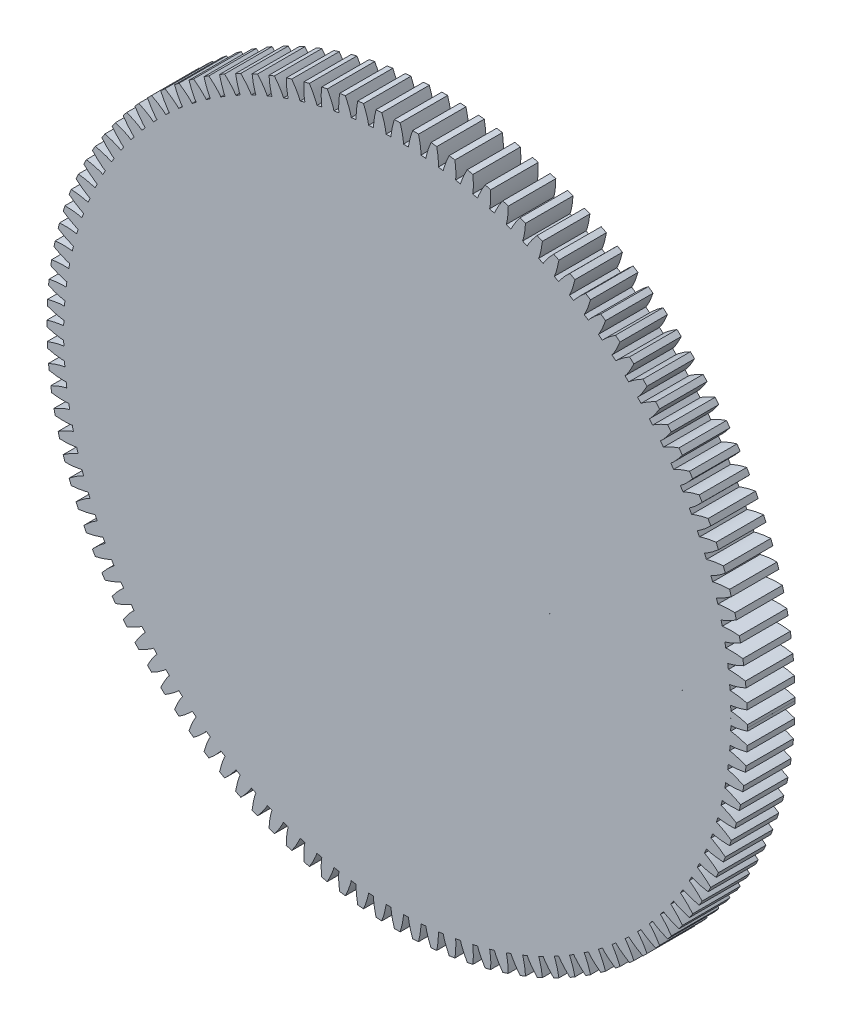
from build123d import *

# Parameters (mm, degrees)
SKETCH1_W          = 51.646666667
SKETCH1_H          = 7
REVOLVE1_ANGLE     = 359.999695921
CUT_EXTRUDE2_DEPTH = 8
CIRPATTERN2_COUNT  = 120


with BuildPart() as part:
    # Sketch1 → Revolve1 (revolve)
    with BuildSketch(Plane(origin=(0, 0, 0), x_dir=(1, 0, 0), z_dir=(0, 1, 0))):
        with Locations((25.823333334, -3.5)):
            Rectangle(SKETCH1_W, SKETCH1_H)
    revolve(axis=Axis((0, 0, 1), (0, 0, 1)), revolution_arc=REVOLVE1_ANGLE)

    # Sketch2 → Cut-Extrude2 (cut, symmetric)
    with BuildSketch(Plane.XY):
        with BuildLine():
            add(Edge.make_bspline(
                [(49.173360836, 0.916442482), (49.18384042, 0.916566717), (49.203665183, 0.916389865), (49.236041745, 0.915655843), (49.281069512, 0.913831713), (49.334507278, 0.910924832), (49.397549658, 0.906541371), (49.466941868, 0.900717551), (49.542570383, 0.893292773), (49.61814797, 0.884920963), (49.693667957, 0.875669666), (49.769018057, 0.865640989), (49.860443016, 0.85252946), (49.97028668, 0.83546689), (50.099019249, 0.813561678), (50.245444605, 0.786397355), (50.395173351, 0.756216682), (50.542926147, 0.724464621), (50.692735499, 0.690005779), (50.838058678, 0.654980248), (50.989598286, 0.61614374), (51.129772372, 0.579049403), (51.287526258, 0.53475208), (51.415036017, 0.498206745), (51.54737887, 0.458157207), (51.611885358, 0.438324893), (51.64489264, 0.428045811)],
                knots=[1.3e-07, 1.3e-07, 1.3e-07, 1.3e-07, 1.3e-07, 0.015083688, 0.02853182, 0.04661014, 0.06485485, 0.092110526, 0.119476176, 0.146842496, 0.174208854, 0.201574956, 0.228941013, 0.256307345, 0.307035032, 0.361767352, 0.416499661, 0.471231937, 0.525964282, 0.580696616, 0.635428982, 0.690161387, 0.744893688, 0.799626082, 0.854358407, 0.909090989, 0.909090989, 0.909090989, 0.909090989, 0.909090989], degree=4))
            add(Edge.make_bspline(
                [(51.64489264, 0.428045811), (51.729651536, 0.428748255), (51.893906687, 0.430109643), (52.306530901, 0.433529575), (52.626157698, 0.436178722), (53.078541106, 0.439928189), (53.448425948, 0.442993886), (53.867627873, 0.446468337), (54.246446373, 0.449608079), (54.654621988, 0.45299114), (55.038305363, 0.456171204), (55.432204014, 0.459435934), (55.822263272, 0.462668842), (56.205473452, 0.465844984), (56.602827488, 0.469138353), (56.995750762, 0.472394999), (57.400093172, 0.47574629), (57.791188074, 0.478987782), (58.210246004, 0.482461039), (58.578360763, 0.485512066), (59.036526598, 0.489309459), (59.34843758, 0.491894655), (59.757270843, 0.495283167), (59.9172769, 0.496609337), (59.997819258, 0.497276892)],
                knots=[0.083333333, 0.083333333, 0.083333333, 0.083333333, 0.083333333, 0.123922085, 0.164486989, 0.203919128, 0.245640644, 0.283463065, 0.324862637, 0.363448184, 0.401437538, 0.443624084, 0.479586386, 0.519793574, 0.557377518, 0.596757987, 0.637386485, 0.67814217, 0.716036134, 0.757316468, 0.797189789, 0.837516216, 0.878097019, 0.916666667, 0.916666667, 0.916666667, 0.916666667, 0.916666667], degree=4))
            add(Edge.make_bspline(
                [(59.997819258, 0.497276892), (59.997642726, 0.518575974), (59.997269865, 0.560059567), (59.996273068, 0.664565782), (59.995261818, 0.744519575), (59.993781282, 0.86011974), (59.992303561, 0.954280053), (59.990545534, 1.061376264), (59.988676117, 1.160666778), (59.986596883, 1.264627477), (59.984361083, 1.365842191), (59.981947021, 1.468566009), (59.97935042, 1.570614564), (59.976602654, 1.672659161), (59.973637258, 1.775368542), (59.970572825, 1.876561557), (59.967208328, 1.9804886), (59.963878718, 2.079740878), (59.960029353, 2.186782325), (59.956577079, 2.280890933), (59.952005541, 2.396410157), (59.948830947, 2.476307301), (59.944356945, 2.580722462), (59.942558211, 2.622168717), (59.941619794, 2.643447849)],
                knots=[0.083333333, 0.083333333, 0.083333333, 0.083333333, 0.083333333, 0.123015873, 0.162698413, 0.202380952, 0.242063492, 0.281746032, 0.321428571, 0.361111111, 0.400793651, 0.44047619, 0.48015873, 0.51984127, 0.55952381, 0.599206349, 0.638888889, 0.678571429, 0.718253968, 0.757936508, 0.797619048, 0.837301587, 0.876984127, 0.916666667, 0.916666667, 0.916666667, 0.916666667, 0.916666667], degree=4))
            add(Edge.make_bspline(
                [(59.941619794, 2.643447849), (59.858319983, 2.639774296), (59.703135353, 2.632930595), (59.312499408, 2.615703403), (59.020783244, 2.60283861), (58.606088921, 2.584550435), (58.260277324, 2.569300013), (57.859465495, 2.551624061), (57.496042248, 2.535596959), (57.099188575, 2.518095563), (56.729728777, 2.501802247), (56.36779352, 2.485840766), (56.0012911, 2.469677871), (55.634949418, 2.453522065), (55.258889689, 2.43693769), (54.870819425, 2.419823645), (54.487394379, 2.402914456), (54.08400337, 2.385124761), (53.704331692, 2.368381097), (53.295388965, 2.350346569), (52.936963291, 2.334539862), (52.521463085, 2.316216147), (52.219639536, 2.302905615), (51.83711307, 2.286036054), (51.677727668, 2.279007097), (51.596517476, 2.275425697)],
                knots=[0.083333333, 0.083333333, 0.083333333, 0.083333333, 0.083333333, 0.123260854, 0.159318546, 0.197811954, 0.233027389, 0.269069906, 0.309877622, 0.349805143, 0.383267774, 0.424652171, 0.459252987, 0.493239183, 0.530412296, 0.570339816, 0.610221809, 0.64719005, 0.685114365, 0.729048295, 0.765971008, 0.80369045, 0.838966589, 0.877740749, 0.916666667, 0.916666667, 0.916666667, 0.916666667, 0.916666667], degree=4))
            add(Edge.make_bspline(
                [(49.153933527, 1.658348376), (49.164405251, 1.658772771), (49.18419359, 1.659986928), (49.216487364, 1.662414403), (49.261357955, 1.666592604), (49.314570352, 1.672292218), (49.377296922, 1.679969055), (49.446289237, 1.689416601), (49.521425523, 1.700789294), (49.596461387, 1.713105056), (49.671393701, 1.726296086), (49.746115676, 1.740254538), (49.836729136, 1.75813291), (49.945529277, 1.78092087), (50.072938992, 1.809533404), (50.217742007, 1.844323811), (50.36568602, 1.882299318), (50.511574552, 1.921740649), (50.659375159, 1.963992682), (50.802666082, 2.006575839), (50.951965465, 2.053290093), (51.09000608, 2.097669738), (51.245225426, 2.150162554), (51.370647803, 2.19333115), (51.500713254, 2.240252091), (51.564093395, 2.263433234), (51.596517476, 2.275425697)],
                knots=[0, 0, 0, 0, 0, 0.015083688, 0.02853182, 0.04661014, 0.06485485, 0.092110526, 0.119476176, 0.146842496, 0.174208854, 0.201574956, 0.228941013, 0.256307345, 0.307035032, 0.361767352, 0.416499661, 0.471231937, 0.525964282, 0.580696616, 0.635428982, 0.690161387, 0.744893688, 0.799626082, 0.854358407, 0.909090914, 0.909090914, 0.909090914, 0.909090914, 0.909090914], degree=4))
            add(Edge.make_bspline(
                [(49.153933527, 1.658348376), (49.154108307, 1.651673792), (49.154470369, 1.637847201), (49.155394419, 1.602559154), (49.156132466, 1.574374293), (49.157191942, 1.53391451), (49.158022611, 1.502192549), (49.158936078, 1.467308675), (49.159760078, 1.435841366), (49.160615387, 1.403178438), (49.161472634, 1.370441506), (49.162329541, 1.337717544), (49.16321808, 1.303785607), (49.164140847, 1.268546544), (49.165096303, 1.232059161), (49.166073376, 1.194746248), (49.167055942, 1.157223577), (49.167961336, 1.122647945), (49.168938851, 1.085318177), (49.169802717, 1.052328445), (49.170922006, 1.009584531), (49.171686192, 0.980401459), (49.172743501, 0.940024439), (49.173154617, 0.924324558), (49.173360836, 0.916442482)],
                knots=[0.083333333, 0.083333333, 0.083333333, 0.083333333, 0.083333333, 0.119319483, 0.159812843, 0.201093178, 0.243303571, 0.280291323, 0.314751221, 0.350761218, 0.38877442, 0.424593636, 0.463226877, 0.497138278, 0.541351877, 0.583276099, 0.626201923, 0.666552198, 0.706902473, 0.743675595, 0.785599817, 0.828954899, 0.874170101, 0.916666667, 0.916666667, 0.916666667, 0.916666667, 0.916666667], degree=4))
        make_face()
    cut_extrude2 = extrude(amount=CUT_EXTRUDE2_DEPTH, both=True, mode=Mode.SUBTRACT)

    # CirPattern2: Cut-Extrude2 ×120 about axis
    cirpattern2_axis = Axis((0, 0, 7), (0, 0, -1))
    for i in range(1, CIRPATTERN2_COUNT):
        add(cut_extrude2.rotate(cirpattern2_axis, i * 360 / CIRPATTERN2_COUNT), mode=Mode.SUBTRACT)


solid = part.part
